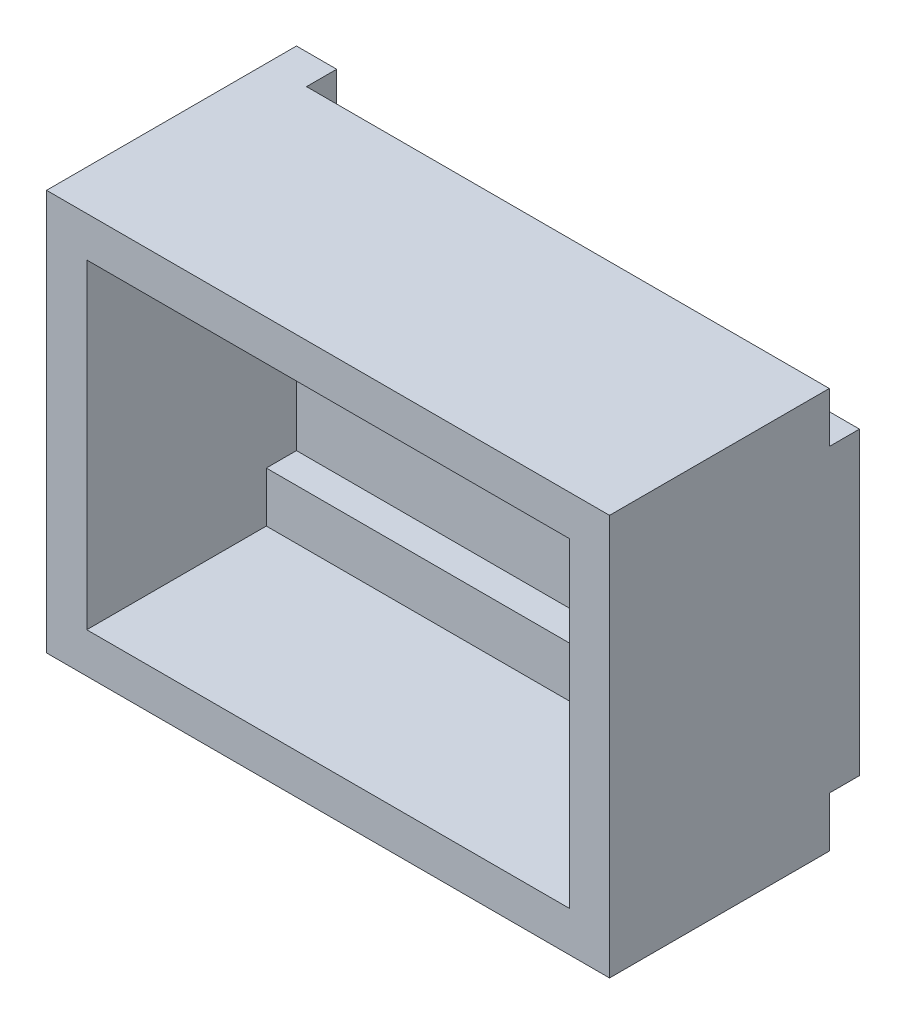
from build123d import *

# Parameters (mm, degrees)
SKETCH2_W           = 19.9273
SKETCH2_H           = 28
BOSS_EXTRUDE1_DEPTH = 12.4298
SKETCH3_W           = 2.5
SKETCH3_H           = 1.5
CUT_EXTRUDE1_DEPTH  = 26
SHELL1_START        = -12
SHELL1_DEPTH        = 24


# Read off the part's stored shape, not the designer's step: Shell1
with BuildPart() as part:
    # Sketch2 → Boss-Extrude1 (new body)
    with BuildSketch(Plane(origin=(0, 0, 0), x_dir=(0, 1, 0), z_dir=(0, 0, 1))):
        Rectangle(SKETCH2_W, SKETCH2_H)
    extrude(amount=BOSS_EXTRUDE1_DEPTH)

    # Sketch3 → Cut-Extrude1 (cut)
    with BuildSketch(Plane.YZ.offset(14)):
        with Locations((-8.71365, 0.75)):
            Rectangle(SKETCH3_W, SKETCH3_H)
        with Locations((8.71365, 0.75)):
            Rectangle(SKETCH3_W, SKETCH3_H)
    extrude(amount=-CUT_EXTRUDE1_DEPTH, mode=Mode.SUBTRACT)

    # Shell1 outline → Shell1 (cut)
    with BuildSketch(Plane.YZ.offset(SHELL1_START)):
        Polygon((7.96365, 3.5), (7.96365, 12.4298), (-7.96365, 12.4298), (-7.96365, 3.5), (-5.46365, 3.5), (-5.46365, 2), (5.46365, 2), (5.46365, 3.5), align=None)
    extrude(amount=SHELL1_DEPTH, mode=Mode.SUBTRACT)


solid = part.part
